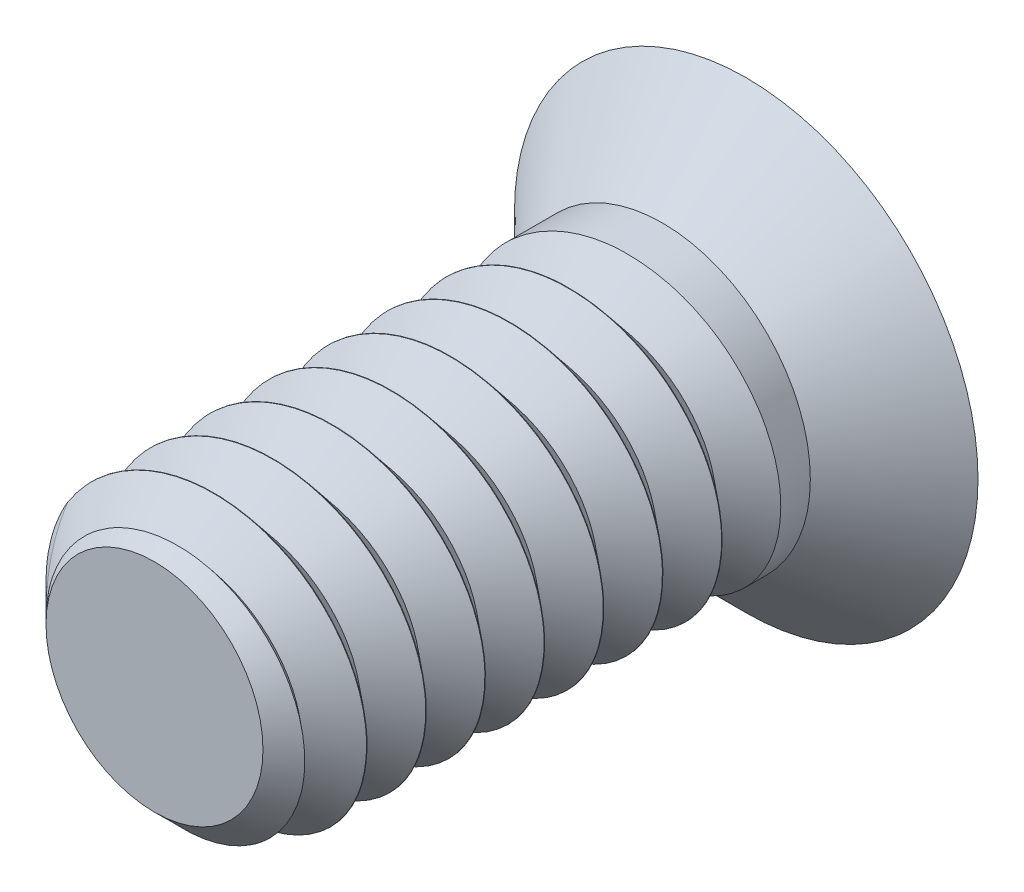
from build123d import *

# Parameters (mm, degrees)
SKETCH1_R           = 3
BOSS_EXTRUDE1_DEPTH = 10
CHAMFER3_SIZE       = 0.8
CUT_SWEEP3_PITCH    = 1.2
SKETCH5_R           = 4.9
BOSS_EXTRUDE2_DEPTH = 2
SKETCH4_W           = 2.08
SKETCH4_H           = 2.08
CUT_EXTRUDE1_DEPTH  = 3
CHAMFER2_SIZE       = 2.2


with BuildPart() as part:
    # Sketch1 → Boss-Extrude1 (new body)
    with BuildSketch(Plane.XY):
        Circle(SKETCH1_R)
    extrude(amount=BOSS_EXTRUDE1_DEPTH)

    # Chamfer3
    chamfer3_edges = [part.edges().sort_by_distance(p)[0] for p in [
        (-3, 0, 10),
    ]]
    chamfer(chamfer3_edges, length=CHAMFER3_SIZE)

    # Cut-Sweep3: the profile of Sketch3 profile screwed along a right-hand helix of 29.166667 turns, 8 arcs to a turn; built about Z, then put on its axis
    cut_sweep3_z = Axis((0, 0, 0), (0, 0, 1))
    cut_sweep3_corners = [(3.0003, 0, 0.595247917), (3.0003, 0, -0.595247917), (2.28, 0, 0)]
    with BuildLine(mode=Mode.PRIVATE) as cut_sweep3_profile:
        Line(cut_sweep3_corners[0], cut_sweep3_corners[1])
        Line(cut_sweep3_corners[1], cut_sweep3_corners[2])
        Line(cut_sweep3_corners[2], cut_sweep3_corners[0])
    cut_sweep3_cap = Face(cut_sweep3_profile.wire())
    cut_sweep3_turn_angles = [0, 22.5, 45, 67.5, 90, 112.5, 135, 157.5, 180, 202.5, 225, 247.5, 270, 292.5, 315, 337.5, 360]
    cut_sweep3_turn_weights = [1, 0.9238795325112867, 1, 0.9238795325112867, 1, 0.9238795325112867, 1, 0.9238795325112867, 1, 0.9238795325112867, 1, 0.9238795325112867, 1, 0.9238795325112867, 1, 0.9238795325112867, 1]
    cut_sweep3_turn_rails = [Edge.make_bspline([Vector(p[0], p[1], 0).rotate(cut_sweep3_z, cut_sweep3_turn_angles[k]) / cut_sweep3_turn_weights[k] + Vector(0, 0, p[2] + CUT_SWEEP3_PITCH * cut_sweep3_turn_angles[k] / 360) for k in range(17)], [0, 0, 0, 1, 1, 2, 2, 3, 3, 4, 4, 5, 5, 6, 6, 7, 7, 8, 8, 8], 2, cut_sweep3_turn_weights) for p in cut_sweep3_corners]
    cut_sweep3_turn_sides = [Face.make_surface_from_curves(cut_sweep3_turn_rails[p[0]], cut_sweep3_turn_rails[p[1]]) for p in [(0, 1), (1, 2), (2, 0)]]
    cut_sweep3_last_angles = [10440, 10462.5, 10485, 10492.5, 10500]
    cut_sweep3_last_weights = [1, 0.9238795325112867, 1, 0.9914448613738477, 1]
    cut_sweep3_last_rails = [Edge.make_bspline([Vector(p[0], p[1], 0).rotate(cut_sweep3_z, cut_sweep3_last_angles[k]) / cut_sweep3_last_weights[k] + Vector(0, 0, p[2] + CUT_SWEEP3_PITCH * cut_sweep3_last_angles[k] / 360) for k in range(5)], [0, 0, 0, 1, 1, 2, 2, 2], 2, cut_sweep3_last_weights) for p in cut_sweep3_corners]
    cut_sweep3_last_sides = [Face.make_surface_from_curves(cut_sweep3_last_rails[p[0]], cut_sweep3_last_rails[p[1]]) for p in [(0, 1), (1, 2), (2, 0)]]
    cut_sweep3 = Plane(origin=(0, 0, 0.6), x_dir=(0, -1, 0), z_dir=(0, 0, 1)) * Solid(Shell([*[p.moved(Location((0, 0, CUT_SWEEP3_PITCH * i))) for i in range(29) for p in cut_sweep3_turn_sides], *cut_sweep3_last_sides, cut_sweep3_cap, cut_sweep3_cap.rotate(cut_sweep3_z, 10500).moved(Location((0, 0, CUT_SWEEP3_PITCH * 10500 / 360)))]))
    add(cut_sweep3, mode=Mode.SUBTRACT)

    # Sketch5 → Boss-Extrude2 (add)
    with BuildSketch(Plane(origin=(0, 0, 0), x_dir=(-1, 0, 0), z_dir=(0, 0, -1))):
        Circle(SKETCH5_R)
    extrude(amount=BOSS_EXTRUDE2_DEPTH)

    # Sketch4 → Cut-Extrude1 (cut)
    with BuildSketch(Plane(origin=(0, 0, -2), x_dir=(-1, 0, 0), z_dir=(0, 0, -1))):
        Rectangle(SKETCH4_W, SKETCH4_H)
    extrude(amount=-CUT_EXTRUDE1_DEPTH, mode=Mode.SUBTRACT)

    # Chamfer2
    # the kernel refuses this chamfer: 2.2 mm, written as the material it takes off along each edge
    with BuildSketch(Plane(origin=(0, 0, 0), x_dir=(-1, 0, 0), z_dir=(0, -1, 0))) as chamfer2_piece_1_section:
        Polygon((4.9, CHAMFER2_SIZE), (4.9 - CHAMFER2_SIZE, 0), (4.9, 0), align=None)
    chamfer2_piece_1 = revolve(axis=Axis((0, 0, 0), (0, 0, -1)), mode=Mode.PRIVATE)
    chamfer2_piece_1 = chamfer2_piece_1 - Plane(origin=(0, 0, -1.252184491), x_dir=(1, 0, 0), z_dir=(0, 0, -1)) * Cylinder(3, 20, mode=Mode.PRIVATE)
    add(chamfer2_piece_1, mode=Mode.SUBTRACT)


solid = part.part
